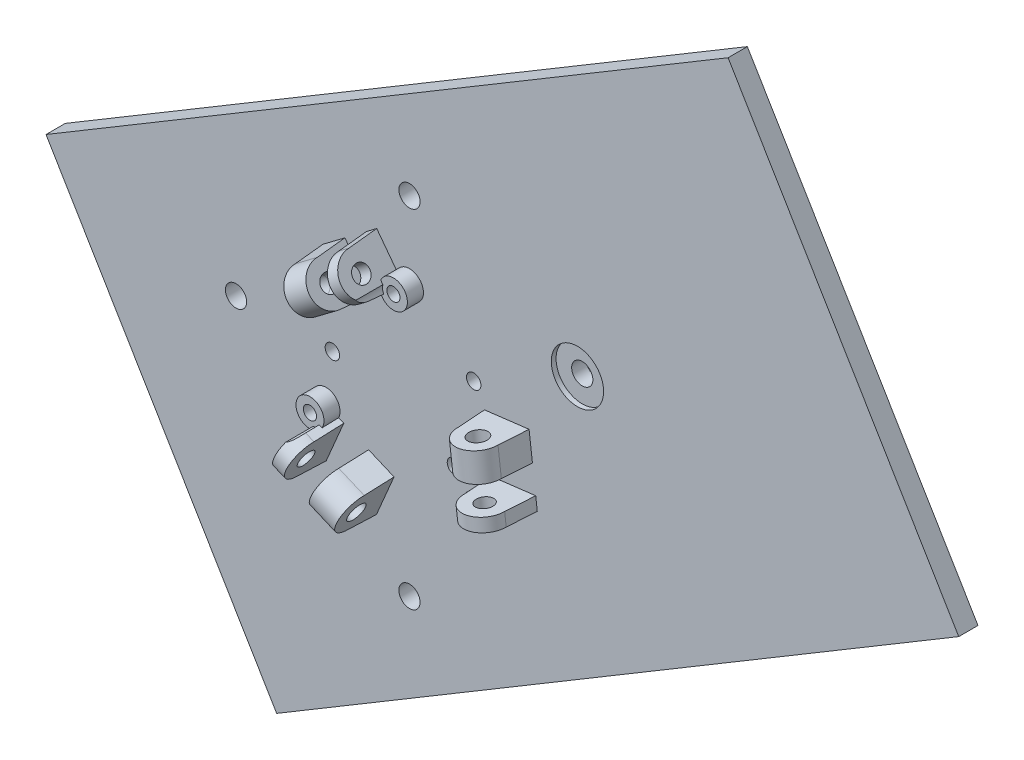
from build123d import *

# Parameters (mm, degrees)
F_01_START                                    = -12
F_01_PULLED_END_PLATE_OUTLINE_DEPTH           = 6
F_02_START                                    = -12.1
S02_CAGE_AND_TRACK_MOUNTING_HOLES_M6_R        = 3.3
F_02_CAGE_AND_TRACK_MOUNTING_HOLES_M6_DEPTH   = 6.2
F_03_START                                    = -12.1
S03_RESERVED_CASSETTE_PATTERN_M4_R            = 2.25
F_03_RESERVED_CASSETTE_PATTERN_M4_DEPTH       = 6.2
F_04_START                                    = -7.5
S04_TRACK_POST_LOCATING_SEAT_R                = 8.15
F_04_TRACK_POST_LOCATING_SEAT_DEPTH           = 1.6
F_05_START                                    = -6
S05_THREE_TENDON_GUIDE_BOSSES_R               = 4.35
F_05_THREE_TENDON_GUIDE_BOSSES_DEPTH          = 5
F_06_START                                    = 4.2
F_06_PIVOT_1_NEAR_CHEEK_DEPTH                 = 4
F_07_START                                    = -12.8
F_07_PIVOT_1_INSERT_CHEEK_DEPTH               = 8.6
F_08_START                                    = -12.9
S08_PIVOT_1_PIN_PILOT_R                       = 2.1
F_08_PIVOT_1_PIN_PILOT_DEPTH                  = 21.2
F_09_START                                    = -7.95
S09_PIVOT_1_SMOOTH_SHOULDER_BEARING_R         = 2.6
F_09_PIVOT_1_SMOOTH_SHOULDER_BEARING_DEPTH    = 16.25
F_10_START                                    = -12.9
S10_PIVOT_1_M4_SHORT_INSERT_SEAT_R            = 2.85
F_10_PIVOT_1_M4_SHORT_INSERT_SEAT_DEPTH       = 5.1
F_11_START                                    = 4.2
F_11_PIVOT_2_NEAR_CHEEK_DEPTH                 = 4
F_12_START                                    = -12.8
F_12_PIVOT_2_INSERT_CHEEK_DEPTH               = 8.6
F_13_START                                    = -12.9
S13_PIVOT_2_PIN_PILOT_R                       = 2.1
F_13_PIVOT_2_PIN_PILOT_DEPTH                  = 21.2
F_14_START                                    = -7.95
S14_PIVOT_2_SMOOTH_SHOULDER_BEARING_R         = 2.6
F_14_PIVOT_2_SMOOTH_SHOULDER_BEARING_DEPTH    = 16.25
F_15_START                                    = -12.9
S15_PIVOT_2_M4_SHORT_INSERT_SEAT_R            = 2.85
F_15_PIVOT_2_M4_SHORT_INSERT_SEAT_DEPTH       = 5.1
F_16_START                                    = 4.2
F_16_PIVOT_3_NEAR_CHEEK_DEPTH                 = 4
F_17_START                                    = -12.8
F_17_PIVOT_3_INSERT_CHEEK_DEPTH               = 8.6
F_18_START                                    = -12.9
S18_PIVOT_3_PIN_PILOT_R                       = 2.1
F_18_PIVOT_3_PIN_PILOT_DEPTH                  = 21.2
F_19_START                                    = -7.95
S19_PIVOT_3_SMOOTH_SHOULDER_BEARING_R         = 2.6
F_19_PIVOT_3_SMOOTH_SHOULDER_BEARING_DEPTH    = 16.25
F_20_START                                    = -12.9
S20_PIVOT_3_M4_SHORT_INSERT_SEAT_R            = 2.85
F_20_PIVOT_3_M4_SHORT_INSERT_SEAT_DEPTH       = 5.1
F_21_START                                    = -12.1
S21_TENDON_EYELET_SEATS_R                     = 2.05
F_21_TENDON_EYELET_SEATS_DEPTH                = 11.2
F_22_START                                    = -1
S22_CLEAR_THE_THREE_EYELET_FLANGES_AND_R      = 3.4
F_22_CLEAR_THE_THREE_EYELET_FLANGES_AND_DEPTH = 12


with BuildPart() as part:
    # S01 - Pulled end plate outline → 01 - Pulled end plate outline (new body)
    with BuildSketch(Plane.XY.offset(F_01_START)):
        Polygon((170.996313, 20.6243307), (-41.3567354, -106.252626), (-113.163433, 13.929728), (99.1896147, 140.806684), align=None)
    extrude(amount=F_01_PULLED_END_PLATE_OUTLINE_DEPTH)

    # S02 - Cage and track mounting holes - M6 → 02 - Cage and track mounting holes - M6 (cut)
    with BuildSketch(Plane.XY.offset(F_02_START)):
        with Locations((0, 54)):
            Circle(S02_CAGE_AND_TRACK_MOUNTING_HOLES_M6_R)
        with Locations((-54, 0)):
            Circle(S02_CAGE_AND_TRACK_MOUNTING_HOLES_M6_R)
        with Locations((0, -54)):
            Circle(S02_CAGE_AND_TRACK_MOUNTING_HOLES_M6_R)
        with Locations((52.287205346, 31.41732257)):
            Circle(S02_CAGE_AND_TRACK_MOUNTING_HOLES_M6_R)
    extrude(amount=F_02_CAGE_AND_TRACK_MOUNTING_HOLES_M6_DEPTH, mode=Mode.SUBTRACT)

    # S03 - Reserved cassette pattern - M4 → 03 - Reserved cassette pattern - M4 (cut)
    with BuildSketch(Plane.XY.offset(F_03_START)):
        with Locations((14, -12)):
            Circle(S03_RESERVED_CASSETTE_PATTERN_M4_R)
        with Locations((20, 14)):
            Circle(S03_RESERVED_CASSETTE_PATTERN_M4_R)
        with Locations((-24, 0)):
            Circle(S03_RESERVED_CASSETTE_PATTERN_M4_R)
    extrude(amount=F_03_RESERVED_CASSETTE_PATTERN_M4_DEPTH, mode=Mode.SUBTRACT)

    # S04 - Track post locating seat → 04 - Track post locating seat (cut)
    with BuildSketch(Plane.XY.offset(F_04_START)):
        with Locations((52.287205346, 31.41732257)):
            Circle(S04_TRACK_POST_LOCATING_SEAT_R)
    extrude(amount=F_04_TRACK_POST_LOCATING_SEAT_DEPTH, mode=Mode.SUBTRACT)

    # S05 - Three tendon guide bosses → 05 - Three tendon guide bosses (add)
    with BuildSketch(Plane.XY.offset(F_05_START)):
        with Locations((25.980762114, -15)):
            Circle(S05_THREE_TENDON_GUIDE_BOSSES_R)
        with Locations((0, 30)):
            Circle(S05_THREE_TENDON_GUIDE_BOSSES_R)
        with Locations((-25.980762114, -15)):
            Circle(S05_THREE_TENDON_GUIDE_BOSSES_R)
    extrude(amount=F_05_THREE_TENDON_GUIDE_BOSSES_DEPTH)

    # S06 - Pivot 1 - near cheek → 06 - Pivot 1 - near cheek (add)
    with BuildSketch(Plane(origin=(0.946263216, -7.706695423, 0), x_dir=(-0.9925461516079791, -0.12186934367670445, 0), z_dir=(0.12186934367670443, -0.992546151607979, 0)).offset(F_06_START)):
        with BuildLine():
            Line((-24.147544543, 6.2), (-38.147544535, 6.2))
            Line((-38.147544535, 6.2), (-37.447544535, -3))
            ThreePointArc((-37.447544535, -3), (-31.147544539, -9.3), (-24.847544543, -3))
            Line((-24.847544543, -3), (-24.147544543, 6.2))
        make_face()
    extrude(amount=F_06_PIVOT_1_NEAR_CHEEK_DEPTH)

    # S07 - Pivot 1 - insert cheek → 07 - Pivot 1 - insert cheek (add)
    with BuildSketch(Plane(origin=(0.946263216, -7.706695423, 0), x_dir=(-0.9925461516079791, -0.12186934367670445, 0), z_dir=(0.12186934367670443, -0.992546151607979, 0)).offset(F_07_START)):
        with BuildLine():
            Line((-24.147544543, 6.2), (-38.147544535, 6.2))
            Line((-38.147544535, 6.2), (-37.447544535, -3))
            ThreePointArc((-37.447544535, -3), (-31.147544539, -9.3), (-24.847544543, -3))
            Line((-24.847544543, -3), (-24.147544543, 6.2))
        make_face()
    extrude(amount=F_07_PIVOT_1_INSERT_CHEEK_DEPTH)

    # S08 - Pivot 1 - pin pilot → 08 - Pivot 1 - pin pilot (cut)
    with BuildSketch(Plane(origin=(0.946263216, -7.706695423, 0), x_dir=(-0.9925461516079791, -0.12186934367670445, 0), z_dir=(0.12186934367670443, -0.992546151607979, 0)).offset(F_08_START)):
        with Locations((-31.147544539, -3)):
            Circle(S08_PIVOT_1_PIN_PILOT_R)
    extrude(amount=F_08_PIVOT_1_PIN_PILOT_DEPTH, mode=Mode.SUBTRACT)

    # S09 - Pivot 1 - smooth shoulder bearing → 09 - Pivot 1 - smooth shoulder bearing (cut)
    with BuildSketch(Plane(origin=(0.946263216, -7.706695423, 0), x_dir=(-0.9925461516079791, -0.12186934367670445, 0), z_dir=(0.12186934367670443, -0.992546151607979, 0)).offset(F_09_START)):
        with Locations((-31.147544539, -3)):
            Circle(S09_PIVOT_1_SMOOTH_SHOULDER_BEARING_R)
    extrude(amount=F_09_PIVOT_1_SMOOTH_SHOULDER_BEARING_DEPTH, mode=Mode.SUBTRACT)

    # S10 - Pivot 1 - M4 short insert seat → 10 - Pivot 1 - M4 short insert seat (cut)
    with BuildSketch(Plane(origin=(0.946263216, -7.706695423, 0), x_dir=(-0.9925461516079791, -0.12186934367670445, 0), z_dir=(0.12186934367670443, -0.992546151607979, 0)).offset(F_10_START)):
        with Locations((-31.147544539, -3)):
            Circle(S10_PIVOT_1_M4_SHORT_INSERT_SEAT_R)
    extrude(amount=F_10_PIVOT_1_M4_SHORT_INSERT_SEAT_DEPTH, mode=Mode.SUBTRACT)

    # S11 - Pivot 2 - near cheek → 11 - Pivot 2 - near cheek (add)
    with BuildSketch(Plane(origin=(6.201062381, 4.672835668, 0), x_dir=(0, 0, -1), z_dir=(0.7986355103156061, 0.6018150227959849, 0)).offset(F_11_START)):
        with BuildLine():
            Line((6.2, 24.14754453), (6.2, 38.147544534))
            Line((6.2, 38.147544534), (-3, 37.447544534))
            ThreePointArc((-3, 37.447544534), (-9.3, 31.147544532), (-3, 24.84754453))
            Line((-3, 24.84754453), (6.2, 24.14754453))
        make_face()
    extrude(amount=F_11_PIVOT_2_NEAR_CHEEK_DEPTH)

    # S12 - Pivot 2 - insert cheek → 12 - Pivot 2 - insert cheek (add)
    with BuildSketch(Plane(origin=(6.201062381, 4.672835668, 0), x_dir=(0, 0, -1), z_dir=(0.7986355103156061, 0.6018150227959849, 0)).offset(F_12_START)):
        with BuildLine():
            Line((6.2, 24.14754453), (6.2, 38.147544534))
            Line((6.2, 38.147544534), (-3, 37.447544534))
            ThreePointArc((-3, 37.447544534), (-9.3, 31.147544532), (-3, 24.84754453))
            Line((-3, 24.84754453), (6.2, 24.14754453))
        make_face()
    extrude(amount=F_12_PIVOT_2_INSERT_CHEEK_DEPTH)

    # S13 - Pivot 2 - pin pilot → 13 - Pivot 2 - pin pilot (cut)
    with BuildSketch(Plane(origin=(6.201062381, 4.672835668, 0), x_dir=(0, 0, -1), z_dir=(0.7986355103156061, 0.6018150227959849, 0)).offset(F_13_START)):
        with Locations((-3, 31.147544532)):
            Circle(S13_PIVOT_2_PIN_PILOT_R)
    extrude(amount=F_13_PIVOT_2_PIN_PILOT_DEPTH, mode=Mode.SUBTRACT)

    # S14 - Pivot 2 - smooth shoulder bearing → 14 - Pivot 2 - smooth shoulder bearing (cut)
    with BuildSketch(Plane(origin=(6.201062381, 4.672835668, 0), x_dir=(0, 0, -1), z_dir=(0.7986355103156061, 0.6018150227959849, 0)).offset(F_14_START)):
        with Locations((-3, 31.147544532)):
            Circle(S14_PIVOT_2_SMOOTH_SHOULDER_BEARING_R)
    extrude(amount=F_14_PIVOT_2_SMOOTH_SHOULDER_BEARING_DEPTH, mode=Mode.SUBTRACT)

    # S15 - Pivot 2 - M4 short insert seat → 15 - Pivot 2 - M4 short insert seat (cut)
    with BuildSketch(Plane(origin=(6.201062381, 4.672835668, 0), x_dir=(0, 0, -1), z_dir=(0.7986355103156061, 0.6018150227959849, 0)).offset(F_15_START)):
        with Locations((-3, 31.147544532)):
            Circle(S15_PIVOT_2_M4_SHORT_INSERT_SEAT_R)
    extrude(amount=F_15_PIVOT_2_M4_SHORT_INSERT_SEAT_DEPTH, mode=Mode.SUBTRACT)

    # S16 - Pivot 3 - near cheek → 16 - Pivot 3 - near cheek (add)
    with BuildSketch(Plane(origin=(-7.147325625, 3.033859732, 0), x_dir=(0, 0, 1), z_dir=(-0.9205048534161142, 0.39073112857485304, 0)).offset(F_16_START)):
        with BuildLine():
            Line((-6.2, -24.147544532), (-6.2, -38.14754453))
            Line((-6.2, -38.14754453), (3, -37.44754453))
            ThreePointArc((3, -37.44754453), (9.3, -31.147544531), (3, -24.847544531))
            Line((3, -24.847544531), (-6.2, -24.147544532))
        make_face()
    extrude(amount=F_16_PIVOT_3_NEAR_CHEEK_DEPTH)

    # S17 - Pivot 3 - insert cheek → 17 - Pivot 3 - insert cheek (add)
    with BuildSketch(Plane(origin=(-7.147325625, 3.033859732, 0), x_dir=(0, 0, 1), z_dir=(-0.9205048534161142, 0.39073112857485304, 0)).offset(F_17_START)):
        with BuildLine():
            Line((-6.2, -24.147544532), (-6.2, -38.14754453))
            Line((-6.2, -38.14754453), (3, -37.44754453))
            ThreePointArc((3, -37.44754453), (9.3, -31.147544531), (3, -24.847544531))
            Line((3, -24.847544531), (-6.2, -24.147544532))
        make_face()
    extrude(amount=F_17_PIVOT_3_INSERT_CHEEK_DEPTH)

    # S18 - Pivot 3 - pin pilot → 18 - Pivot 3 - pin pilot (cut)
    with BuildSketch(Plane(origin=(-7.147325625, 3.033859732, 0), x_dir=(0, 0, 1), z_dir=(-0.9205048534161142, 0.39073112857485304, 0)).offset(F_18_START)):
        with Locations((3, -31.147544531)):
            Circle(S18_PIVOT_3_PIN_PILOT_R)
    extrude(amount=F_18_PIVOT_3_PIN_PILOT_DEPTH, mode=Mode.SUBTRACT)

    # S19 - Pivot 3 - smooth shoulder bearing → 19 - Pivot 3 - smooth shoulder bearing (cut)
    with BuildSketch(Plane(origin=(-7.147325625, 3.033859732, 0), x_dir=(0, 0, 1), z_dir=(-0.9205048534161142, 0.39073112857485304, 0)).offset(F_19_START)):
        with Locations((3, -31.147544531)):
            Circle(S19_PIVOT_3_SMOOTH_SHOULDER_BEARING_R)
    extrude(amount=F_19_PIVOT_3_SMOOTH_SHOULDER_BEARING_DEPTH, mode=Mode.SUBTRACT)

    # S20 - Pivot 3 - M4 short insert seat → 20 - Pivot 3 - M4 short insert seat (cut)
    with BuildSketch(Plane(origin=(-7.147325625, 3.033859732, 0), x_dir=(0, 0, 1), z_dir=(-0.9205048534161142, 0.39073112857485304, 0)).offset(F_20_START)):
        with Locations((3, -31.147544531)):
            Circle(S20_PIVOT_3_M4_SHORT_INSERT_SEAT_R)
    extrude(amount=F_20_PIVOT_3_M4_SHORT_INSERT_SEAT_DEPTH, mode=Mode.SUBTRACT)

    # S21 - Tendon eyelet seats → 21 - Tendon eyelet seats (cut)
    with BuildSketch(Plane.XY.offset(F_21_START)):
        with Locations((25.980762114, -15)):
            Circle(S21_TENDON_EYELET_SEATS_R)
        with Locations((0, 30)):
            Circle(S21_TENDON_EYELET_SEATS_R)
        with Locations((-25.980762114, -15)):
            Circle(S21_TENDON_EYELET_SEATS_R)
    extrude(amount=F_21_TENDON_EYELET_SEATS_DEPTH, mode=Mode.SUBTRACT)

    # S22 - Clear the three eyelet flanges and cord exits → 22 - Clear the three eyelet flanges and cord exits (cut)
    with BuildSketch(Plane.XY.offset(F_22_START)):
        with Locations((25.980762114, -15)):
            Circle(S22_CLEAR_THE_THREE_EYELET_FLANGES_AND_R)
        with Locations((0, 30)):
            Circle(S22_CLEAR_THE_THREE_EYELET_FLANGES_AND_R)
        with Locations((-25.980762114, -15)):
            Circle(S22_CLEAR_THE_THREE_EYELET_FLANGES_AND_R)
    extrude(amount=F_22_CLEAR_THE_THREE_EYELET_FLANGES_AND_DEPTH, mode=Mode.SUBTRACT)


solid = part.part
